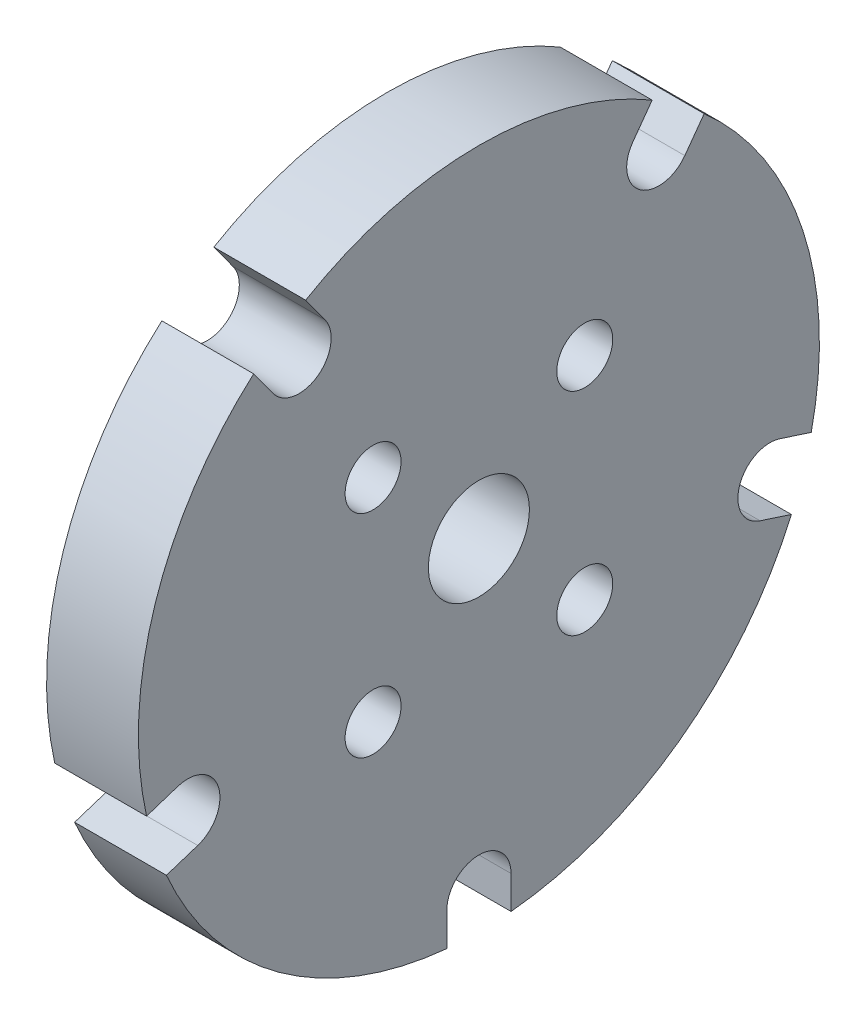
from build123d import *

# Parameters (mm, degrees)
ESQUISSE1_R                                      = 22.25
BOSS_EXTRU_1_DEPTH                               = 6
ENL_V_MAT_EXTRU_1_REACH                          = 34.033
R_P_TITION_CIRCULAIRE1_COUNT                     = 5
ENL_V_MAT_EXTRU_2_REACH                          = 34.033
ESQUISSE6_R                                      = 3.3
CHAMBRAGE_POUR_VIS_T_TE_RONDE_BOMB_E_D           = 3.6576
CHAMBRAGE_POUR_VIS_T_TE_RONDE_BOMB_E_CBORE_D     = 7.54126
CHAMBRAGE_POUR_VIS_T_TE_RONDE_BOMB_E_CBORE_DEPTH = 2.4638


with BuildPart() as part:
    # Esquisse1 → Boss.-Extru.1 (new body)
    with BuildSketch(Plane(origin=(0, 0, 0), x_dir=(0, 0, -1), z_dir=(1, 0, 0))):
        Circle(ESQUISSE1_R)
    extrude(amount=BOSS_EXTRU_1_DEPTH)

    # Esquisse5 → Enlèv. mat.-Extru.1 (cut, up to next)
    with BuildSketch(Plane(origin=(6, 0, 0), x_dir=(0, 0, -1), z_dir=(1, 0, 0)), mode=Mode.PRIVATE) as enl_v_mat_extru_1_sk1:
        with BuildLine():
            Line((2.1, -20), (2.1, -24.5))
            ThreePointArc((2.1, -24.5), (0, -26.6), (-2.1, -24.5))
            Line((-2.1, -24.5), (-2.1, -20))
            ThreePointArc((-2.1, -20), (0, -17.9), (2.1, -20))
        make_face()
    enl_v_mat_extru_1_tool1 = extrude(enl_v_mat_extru_1_sk1.sketch, amount=-ENL_V_MAT_EXTRU_1_REACH, mode=Mode.PRIVATE) & part.part
    enl_v_mat_extru_1 = enl_v_mat_extru_1_tool1.solids().sort_by_distance((6, -22.25, 0))[0]
    add(enl_v_mat_extru_1, mode=Mode.SUBTRACT)

    # Répétition circulaire1: Enlèv. mat.-Extru.1 ×5 about axis
    r_p_tition_circulaire1_axis = Axis((6, 0, 0), (1, 0, 0))
    for i in range(1, R_P_TITION_CIRCULAIRE1_COUNT):
        add(enl_v_mat_extru_1.rotate(r_p_tition_circulaire1_axis, i * 360 / R_P_TITION_CIRCULAIRE1_COUNT), mode=Mode.SUBTRACT)

    # Esquisse6 → Enlèv. mat.-Extru.2 (cut, up to next)
    with BuildSketch(Plane(origin=(6, 0, 0), x_dir=(0, 0, -1), z_dir=(1, 0, 0)), mode=Mode.PRIVATE) as enl_v_mat_extru_2_sk1:
        Circle(ESQUISSE6_R)
    enl_v_mat_extru_2_tool1 = extrude(enl_v_mat_extru_2_sk1.sketch, amount=-ENL_V_MAT_EXTRU_2_REACH, mode=Mode.PRIVATE) & part.part
    add(enl_v_mat_extru_2_tool1.solids().sort_by_distance((6, 0, 0))[0], mode=Mode.SUBTRACT)

    # Chambrage pour vis à tête ronde bombée #61 (through all)
    with Locations(Plane.ZY):
        with Locations((-6.914797213, 6.914797213), (6.914797213, 6.914797213), (6.914797213, -6.914797213), (-6.914797213, -6.914797213)):
            CounterBoreHole(CHAMBRAGE_POUR_VIS_T_TE_RONDE_BOMB_E_D / 2, CHAMBRAGE_POUR_VIS_T_TE_RONDE_BOMB_E_CBORE_D / 2, CHAMBRAGE_POUR_VIS_T_TE_RONDE_BOMB_E_CBORE_DEPTH)


solid = part.part
